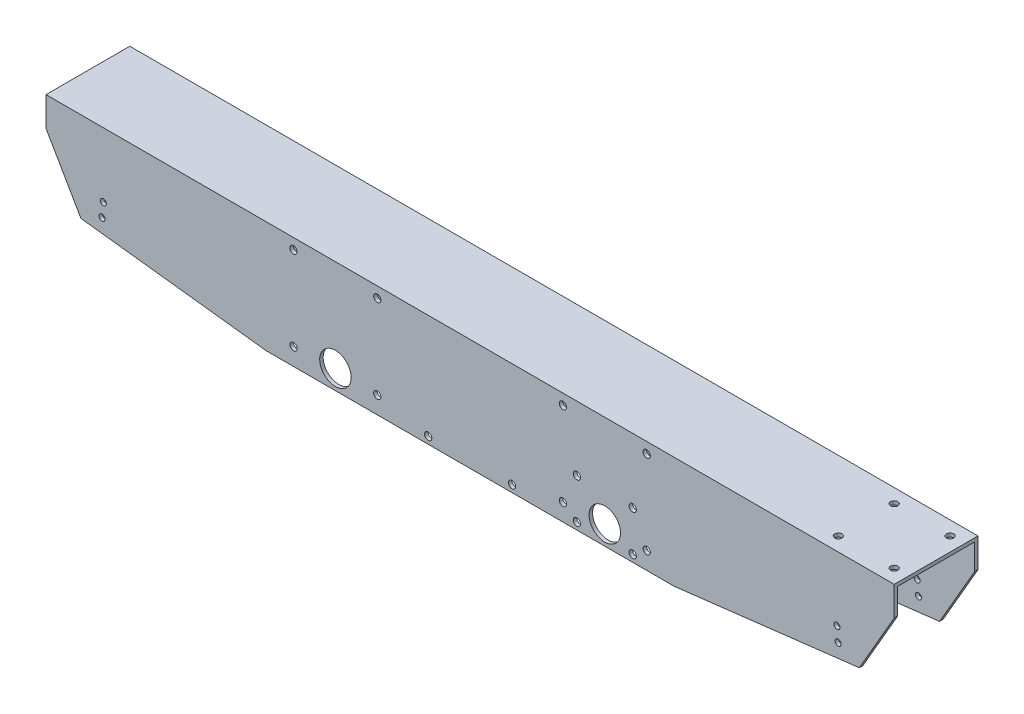
from build123d import *

# Parameters (mm, degrees)
BOSS_EXTRUDE1_DEPTH                     = 385.705756272
SKETCH2_R                               = 2.749999961
SKETCH2_R_2                             = 2.75
SKETCH2_R_3                             = 3.302
SKETCH2_R_4                             = 14.2875
AXLES_DEPTH                             = 141.732
FLANIGAN_MOUNTING_HOLES_R               = 3.3
FLANIGAN_MOUNTING_HOLES_EXTRUSION_DEPTH = 397.429073633
BEVELED_ENDS_DEPTH                      = 101.6
SKETCH32_R                              = 3.3
BELT_SHIELD_HOLES_DEPTH                 = 397.429073633
SKETCH37_R                              = 3.3
CUT_EXTRUDE26_DEPTH                     = 401.678300412


with BuildPart() as part:
    # Sketch1 → Boss-Extrude1 (new, symmetric)
    with BuildSketch(Plane(origin=(0, 0, 0), x_dir=(0, 0, -1), z_dir=(1, 0, 0))):
        Polygon((-38.1, 50.8), (38.1, 50.8), (38.1, -50.8), (34.925, -50.8), (34.925, 47.625), (-34.925, 47.625), (-34.925, -50.8), (-38.1, -50.8), align=None)
    extrude(amount=BOSS_EXTRUDE1_DEPTH, both=True)

    # Sketch2 → Axles (cut)
    with BuildSketch(Plane.XY.offset(38.1)):
        with Locations((-333.577237048, -7.874)):
            Circle(SKETCH2_R)
        with Locations((334.720333616, -20.574)):
            Circle(SKETCH2_R_2)
        with Locations((333.577237048, -7.874)):
            Circle(SKETCH2_R)
        with Locations((160.6, 41.08)):
            Circle(SKETCH2_R_3)
        with Locations((-160.6, -35.12)):
            Circle(SKETCH2_R_3)
        with Locations((-160.6, 41.08)):
            Circle(SKETCH2_R_3)
        with Locations((-122.5, -33.274)):
            Circle(SKETCH2_R_4)
        with Locations((-334.720333616, -20.574)):
            Circle(SKETCH2_R_2)
        with Locations((-84.4, 41.08)):
            Circle(SKETCH2_R_3)
        with Locations((-84.4, -35.12)):
            Circle(SKETCH2_R_3)
        with Locations((84.4, 41.08)):
            Circle(SKETCH2_R_3)
        with Locations((84.4, -35.12)):
            Circle(SKETCH2_R_3)
        with Locations((160.6, -35.12)):
            Circle(SKETCH2_R_3)
        with Locations((122.5, -33.274)):
            Circle(SKETCH2_R_4)
    extrude(amount=-AXLES_DEPTH, mode=Mode.SUBTRACT)

    # Flanigan mounting holes → Flanigan mounting holes extrusion (cut, through all)
    with BuildSketch(Plane.XY.offset(38.1)):
        with Locations((97.1, -7.87)):
            Circle(FLANIGAN_MOUNTING_HOLES_R)
        with Locations((97.1, -44.45)):
            Circle(FLANIGAN_MOUNTING_HOLES_R)
        with Locations((147.9, -7.87)):
            Circle(FLANIGAN_MOUNTING_HOLES_R)
        with Locations((147.9, -44.45)):
            Circle(FLANIGAN_MOUNTING_HOLES_R)
    extrude(amount=-FLANIGAN_MOUNTING_HOLES_EXTRUSION_DEPTH, mode=Mode.SUBTRACT)

    # Sketch16 → Beveled ends (cut)
    with BuildSketch(Plane.XY.offset(38.1)):
        Polygon((-353.951491467, -30.8), (-185.705756272, -50.8), (-385.705756272, -50.8), (-385.705756272, 24.2), align=None)
        Polygon((385.705756272, -50.8), (185.705756272, -50.8), (353.951491467, -30.8), (385.705756272, 24.2), align=None)
    extrude(amount=-BEVELED_ENDS_DEPTH, mode=Mode.SUBTRACT)

    # Sketch32 → Belt shield holes (cut, through all)
    with BuildSketch(Plane(origin=(0, 0, -38.1), x_dir=(-1, 0, 0), z_dir=(0, 0, -1))):
        with Locations((-38.1, -44.45)):
            Circle(SKETCH32_R)
        with Locations((38.1, -44.45)):
            Circle(SKETCH32_R)
    extrude(amount=-BELT_SHIELD_HOLES_DEPTH, mode=Mode.SUBTRACT)

    # Sketch37 → Cut-Extrude26 (cut, through all)
    with BuildSketch(Plane(origin=(0, 50.8, 0), x_dir=(1, 0, 0), z_dir=(0, 1, 0))):
        with Locations((373.005756272, 25.4)):
            Circle(SKETCH37_R)
        with Locations((373.005756272, -25.4)):
            Circle(SKETCH37_R)
        with Locations((322.205756272, 25.4)):
            Circle(SKETCH37_R)
        with Locations((322.205756272, -25.4)):
            Circle(SKETCH37_R)
    extrude(amount=-CUT_EXTRUDE26_DEPTH, mode=Mode.SUBTRACT)


solid = part.part
